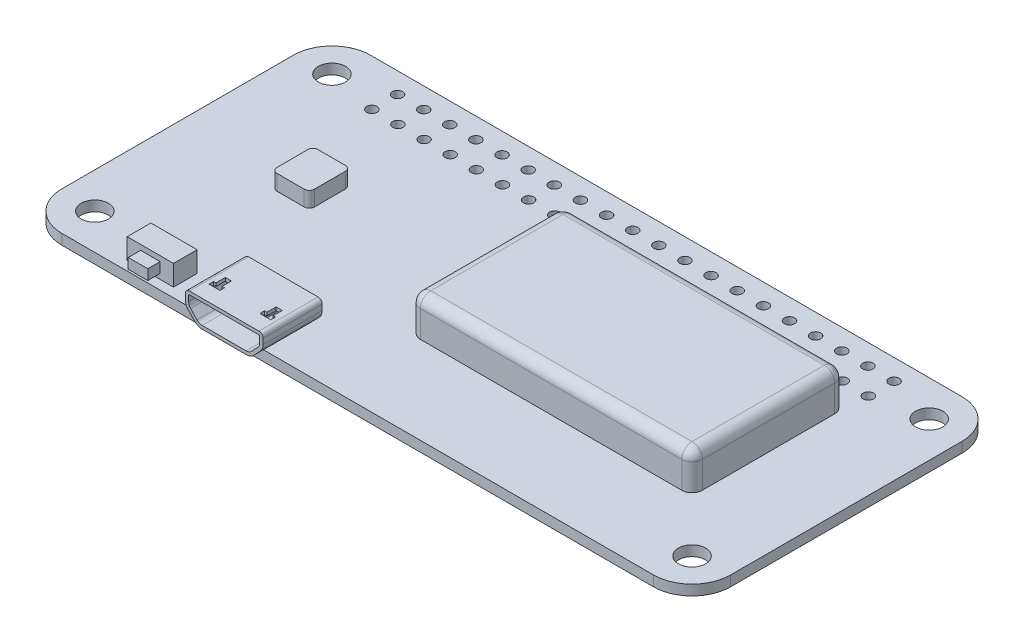
from build123d import *

# Parameters (mm, degrees)
BOSS_EXTRUDE1_DEPTH      = 1
SKETCH2_R                = 1.325
CUT_EXTRUDE1_DEPTH       = 36.80851854
SKETCH3_R                = 0.5
CUT_EXTRUDE2_DEPTH       = 36.80851854
LPATTERN1_COUNT          = 20
LPATTERN1_PITCH          = 2.54
BOSS_EXTRUDE6_DEPTH      = 1.25
BOSS_EXTRUDE6_DEPTH_BACK = 4.5
CUT_EXTRUDE9_DEPTH       = 5.25
SKETCH17_W               = 3.15
SKETCH17_H               = 0.4
BOSS_EXTRUDE7_DEPTH      = 3.5
CUT_EXTRUDE10_REACH      = 38.514
SKETCH22_W               = 3.65
SKETCH22_H               = 4
BOSS_EXTRUDE11_DEPTH     = 1.5
FILLET5_R                = 0.5
SKETCH6_W                = 27.4
SKETCH6_H                = 14.85
BOSS_EXTRUDE12_DEPTH     = 3.6
FILLET4_R                = 1
SKETCH23_W               = 4.5
SKETCH23_H               = 2.3
BOSS_EXTRUDE13_DEPTH     = 2
SKETCH24_W               = 1.9
SKETCH24_H               = 1
BOSS_EXTRUDE14_DEPTH     = 1.2
SKETCH25_W               = 3.3
SKETCH25_H               = 0.93
BOSS_EXTRUDE15_DEPTH     = 1
FILLET6_R                = 0.5
SKETCH26_W               = 0.9
SKETCH26_H               = 0.93
BOSS_EXTRUDE16_DEPTH     = 0.7
FILLET7_R                = 0.5
SKETCH27_W               = 2
SKETCH27_H               = 1.3
BOSS_EXTRUDE17_DEPTH     = 0.2
SKETCH28_W               = 1.2
SKETCH28_H               = 1.3
BOSS_EXTRUDE18_DEPTH     = 0.6


with BuildPart() as part:
    # Sketch1 → Boss-Extrude1 (new body)
    with BuildSketch(Plane(origin=(0, 0, 0), x_dir=(1, 0, 0), z_dir=(0, 1, 0))):
        with BuildLine():
            Line((-28.75, 15), (28.75, 15))
            ThreePointArc((28.75, 15), (31.401650429, 13.901650429), (32.5, 11.25))
            Line((32.5, 11.25), (32.5, -11.25))
            ThreePointArc((32.5, -11.25), (31.401650429, -13.901650429), (28.75, -15))
            Line((28.75, -15), (-28.75, -15))
            ThreePointArc((-28.75, -15), (-31.401650429, -13.901650429), (-32.5, -11.25))
            Line((-32.5, -11.25), (-32.5, 11.25))
            ThreePointArc((-32.5, 11.25), (-31.401650429, 13.901650429), (-28.75, 15))
        make_face()
    extrude(amount=BOSS_EXTRUDE1_DEPTH)

    # Sketch2 → Cut-Extrude1 (cut, through all)
    with BuildSketch(Plane(origin=(0, 1, 0), x_dir=(1, 0, 0), z_dir=(0, 1, 0))):
        with Locations(Location((-29.025, 11.525, 0), (0, 0, 270))):
            Circle(SKETCH2_R)
        with Locations(Location((29.025, 11.525, 0), (0, 0, 90))):
            Circle(SKETCH2_R)
        with Locations(Location((29.025, -11.525, 0), (0, 0, 270))):
            Circle(SKETCH2_R)
        with Locations(Location((-29.025, -11.525, 0), (0, 0, 90))):
            Circle(SKETCH2_R)
    extrude(amount=-CUT_EXTRUDE1_DEPTH, mode=Mode.SUBTRACT)

    # Sketch3 → Cut-Extrude2 (cut, through all)
    with BuildSketch(Plane(origin=(0, 1, 0), x_dir=(1, 0, 0), z_dir=(0, 1, 0))):
        with Locations(Location((-24.128, 13, 0), (0, 0, 270))):
            Circle(SKETCH3_R)
        with Locations(Location((-24.128, 10.5, 0), (0, 0, 270))):
            Circle(SKETCH3_R)
    cut_extrude2 = extrude(amount=-CUT_EXTRUDE2_DEPTH, mode=Mode.SUBTRACT)

    # LPattern1: Cut-Extrude2 ×20
    with Locations(*[(i * LPATTERN1_PITCH, 0, 0) for i in range(1, LPATTERN1_COUNT)]):
        add(cut_extrude2, mode=Mode.SUBTRACT)

    # Sketch15 → Boss-Extrude6 (add, two sides: drawn at the far end of the back side and taken through both)
    with BuildSketch(Plane.XY.offset(15).offset(-BOSS_EXTRUDE6_DEPTH_BACK)):
        with BuildLine():
            Line((-15.1, 3.6), (-8.35, 3.6))
            ThreePointArc((-8.35, 3.6), (-8.067157288, 3.482842712), (-7.95, 3.2))
            Line((-7.95, 3.2), (-7.95, 2.652310288))
            ThreePointArc((-7.95, 2.652310288), (-8.022264229, 2.279072643), (-8.228612679, 1.959778459))
            Line((-8.228612679, 1.959778459), (-8.854830555, 1.307468172))
            ThreePointArc((-8.854830555, 1.307468172), (-9.184128491, 1.080072876), (-9.576217876, 1))
            Line((-9.576217876, 1), (-13.873782124, 1))
            ThreePointArc((-13.873782124, 1), (-14.265871509, 1.080072876), (-14.595169445, 1.307468172))
            Line((-14.595169445, 1.307468172), (-15.221387321, 1.959778459))
            ThreePointArc((-15.221387321, 1.959778459), (-15.427735771, 2.279072643), (-15.5, 2.652310288))
            Line((-15.5, 2.652310288), (-15.5, 3.2))
            ThreePointArc((-15.5, 3.2), (-15.382842712, 3.482842712), (-15.1, 3.6))
        make_face()
    extrude(amount=BOSS_EXTRUDE6_DEPTH + BOSS_EXTRUDE6_DEPTH_BACK)

    # Sketch16 → Cut-Extrude9 (cut)
    with BuildSketch(Plane.XY.offset(16.25)):
        with BuildLine():
            Line((-9.085674498, 1.529078357), (-8.459456622, 2.181388644))
            ThreePointArc((-8.459456622, 2.181388644), (-8.319139676, 2.398508689), (-8.27, 2.652310288))
            Line((-8.27, 2.652310288), (-8.27, 3.2))
            ThreePointArc((-8.27, 3.2), (-8.293431458, 3.256568542), (-8.35, 3.28))
            Line((-8.35, 3.28), (-15.1, 3.28))
            ThreePointArc((-15.1, 3.28), (-15.156568542, 3.256568542), (-15.18, 3.2))
            Line((-15.18, 3.2), (-15.18, 2.652310288))
            ThreePointArc((-15.18, 2.652310288), (-15.130860324, 2.398508689), (-14.990543378, 2.181388644))
            Line((-14.990543378, 2.181388644), (-14.364325502, 1.529078357))
            ThreePointArc((-14.364325502, 1.529078357), (-14.140402906, 1.374449555), (-13.873782124, 1.32))
            Line((-13.873782124, 1.32), (-9.576217876, 1.32))
            ThreePointArc((-9.576217876, 1.32), (-9.309597094, 1.374449555), (-9.085674498, 1.529078357))
        make_face()
    extrude(amount=-CUT_EXTRUDE9_DEPTH, mode=Mode.SUBTRACT)

    # Sketch17 → Boss-Extrude7 (add)
    with BuildSketch(Plane.XY.offset(11)):
        with Locations((-11.725, 2.72)):
            Rectangle(SKETCH17_W, SKETCH17_H)
    extrude(amount=BOSS_EXTRUDE7_DEPTH)

    # Sketch18 → Cut-Extrude10 (cut, up to next)
    with BuildSketch(Plane(origin=(0, 3.6, 0), x_dir=(1, 0, 0), z_dir=(0, 1, 0)), mode=Mode.PRIVATE) as cut_extrude10_sk1:
        Polygon((-14.5, -13.37), (-14.5, -14.27), (-14.725, -14.27), (-14.725, -14.72), (-13.675, -14.72), (-13.675, -14.27), (-13.9, -14.27), (-13.9, -13.37), align=None)
    cut_extrude10_tool1 = extrude(cut_extrude10_sk1.sketch, amount=-CUT_EXTRUDE10_REACH, mode=Mode.PRIVATE) & part.part
    # Sketch18 → Cut-Extrude10 (cut, up to next)
    with BuildSketch(Plane(origin=(0, 3.6, 0), x_dir=(1, 0, 0), z_dir=(0, 1, 0)), mode=Mode.PRIVATE) as cut_extrude10_sk2:
        Polygon((-9.55, -13.37), (-9.55, -14.27), (-9.775, -14.27), (-9.775, -14.72), (-8.725, -14.72), (-8.725, -14.27), (-8.95, -14.27), (-8.95, -13.37), align=None)
    cut_extrude10_tool2 = extrude(cut_extrude10_sk2.sketch, amount=-CUT_EXTRUDE10_REACH, mode=Mode.PRIVATE) & part.part
    add(cut_extrude10_tool1.solids().sort_by_distance((-14.2, 3.6, 14.135))[0], mode=Mode.SUBTRACT)
    add(cut_extrude10_tool2.solids().sort_by_distance((-9.25, 3.6, 14.135))[0], mode=Mode.SUBTRACT)

    # Sketch22 → Boss-Extrude11 (add)
    with BuildSketch(Plane(origin=(0, 1, 0), x_dir=(1, 0, 0), z_dir=(0, 1, 0))):
        with Locations((-20.525, 1)):
            Rectangle(SKETCH22_W, SKETCH22_H)
    extrude(amount=BOSS_EXTRUDE11_DEPTH)

    # Fillet5
    fillet5_edges = [part.edges().sort_by_distance(p)[0] for p in [
        (-22.35, 1.75, -3),
        (-22.35, 1.75, 1),
        (-18.7, 1.75, 1),
        (-18.7, 1.75, -3),
    ]]
    fillet(fillet5_edges, radius=FILLET5_R)

    # Sketch6 → Boss-Extrude12 (add)
    with BuildSketch(Plane(origin=(0, 1, 0), x_dir=(1, 0, 0), z_dir=(0, 1, 0))):
        with Locations((10.3, 0.925)):
            Rectangle(SKETCH6_W, SKETCH6_H)
    extrude(amount=BOSS_EXTRUDE12_DEPTH)

    # Fillet4
    fillet4_edges = [part.edges().sort_by_distance(p)[0] for p in [
        (24, 2.8, 6.5),
        (24, 2.8, -8.35),
        (-3.4, 2.8, -8.35),
        (-3.4, 2.8, 6.5),
        (24, 4.6, -0.925),
        (10.3, 4.6, -8.35),
        (-3.4, 4.6, -0.925),
        (10.3, 4.6, 6.5),
    ]]
    fillet(fillet4_edges, radius=FILLET4_R)

    # Sketch23 → Boss-Extrude13 (add)
    with BuildSketch(Plane(origin=(0, 1, 0), x_dir=(1, 0, 0), z_dir=(0, 1, 0))):
        with Locations((-21.05, -12.95)):
            Rectangle(SKETCH23_W, SKETCH23_H)
    extrude(amount=BOSS_EXTRUDE13_DEPTH)

    # Sketch24 → Boss-Extrude14 (add)
    with BuildSketch(Plane.XY.offset(14.1)):
        with Locations((-21.05, 2)):
            Rectangle(SKETCH24_W, SKETCH24_H)
    extrude(amount=BOSS_EXTRUDE14_DEPTH)

    # Sketch25 → Boss-Extrude15 (add)
    with BuildSketch(Plane.XZ):
        with Locations((-20.75, 11.635)):
            Rectangle(SKETCH25_W, SKETCH25_H)
        with Locations((-20.75, 9.135)):
            Rectangle(SKETCH25_W, SKETCH25_H)
    extrude(amount=BOSS_EXTRUDE15_DEPTH)

    # Fillet6
    fillet6_edges = [part.edges().sort_by_distance(p)[0] for p in [
        (-19.1, -1, 11.635),
        (-19.1, -1, 9.135),
    ]]
    fillet(fillet6_edges, radius=FILLET6_R)

    # Sketch26 → Boss-Extrude16 (add)
    with BuildSketch(Plane.XZ.offset(1)):
        with Locations((-21.65, 11.635)):
            Rectangle(SKETCH26_W, SKETCH26_H)
        with Locations((-21.65, 9.135)):
            Rectangle(SKETCH26_W, SKETCH26_H)
    extrude(amount=BOSS_EXTRUDE16_DEPTH)

    # Fillet7
    # the kernel refuses this fillet: 0.5 mm, written as the material it takes off along each edge
    with BuildSketch(Plane(origin=(-22.1, -1.7, 13.35), x_dir=(0, 1, 0), z_dir=(0, 0, -1)), Plane(origin=(-21.2, -1.7, 9.92), x_dir=(0, 1, 0), z_dir=(0, 0, 1)), Plane(origin=(-22.1, -1.7, 10.85), x_dir=(0, 1, 0), z_dir=(0, 0, -1)), Plane(origin=(-21.2, -1.7, 7.42), x_dir=(0, 1, 0), z_dir=(0, 0, 1))) as fillet7_piece_1:
        with BuildLine():
            CenterArc((FILLET7_R, FILLET7_R), FILLET7_R, 180, 90)
            Line((0, FILLET7_R), (0, 0))
            Line((0, 0), (FILLET7_R, 0))
        make_face()
    extrude(amount=3.43, mode=Mode.SUBTRACT)

    # Sketch27 → Boss-Extrude17 (add)
    with BuildSketch(Plane.XZ):
        with Locations((-29.5, 6.75)):
            Rectangle(SKETCH27_W, SKETCH27_H)
        with Locations((-29.5, 2.25)):
            Rectangle(SKETCH27_W, SKETCH27_H)
        with Locations((-29.5, -2.25)):
            Rectangle(SKETCH27_W, SKETCH27_H)
        with Locations((-29.5, -6.75)):
            Rectangle(SKETCH27_W, SKETCH27_H)
    extrude(amount=BOSS_EXTRUDE17_DEPTH)

    # Sketch28 → Boss-Extrude18 (add)
    with BuildSketch(Plane.XZ.offset(0.2)):
        with Locations((-29.5, 6.75)):
            Rectangle(SKETCH28_W, SKETCH28_H)
        with Locations((-29.5, 2.25)):
            Rectangle(SKETCH28_W, SKETCH28_H)
        with Locations((-29.5, -2.25)):
            Rectangle(SKETCH28_W, SKETCH28_H)
        with Locations((-29.5, -6.75)):
            Rectangle(SKETCH28_W, SKETCH28_H)
    extrude(amount=BOSS_EXTRUDE18_DEPTH)


solid = part.part
